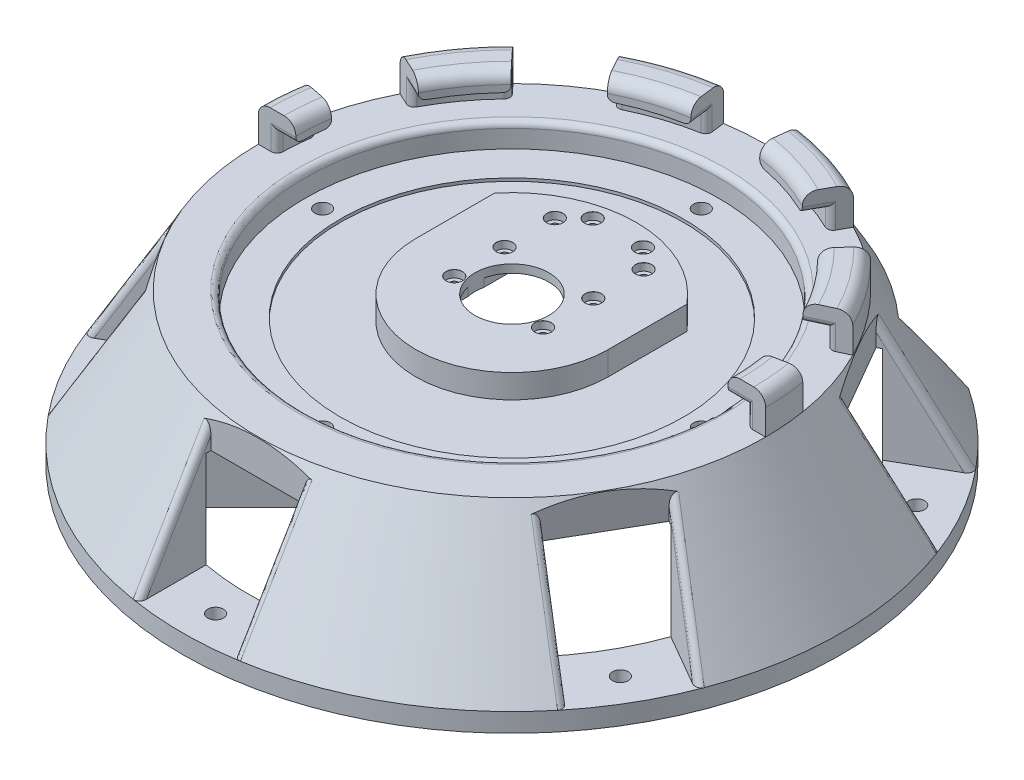
from build123d import *

# Parameters (mm, degrees)
SKETCH2_R                       = 12.5
CUT_EXTRUDE1_DEPTH              = 171.457229262
SKETCH3_R                       = 69.999999954
CUT_EXTRUDE2_DEPTH              = 8.000000002
CUT_EXTRUDE5_DEPTH              = 39
SKETCH8_W                       = 31.75
SKETCH8_H                       = 38.1
CUT_EXTRUDE6_DEPTH              = 44.45
CIRPATTERN2_COUNT               = 6
REVOLVE2_ANGLE                  = 180
CUT_EXTRUDE9_DEPTH              = 12.7
SKETCH3_3_R                     = 12.5
CUT_EXTRUDE11_DEPTH             = 1
CBORE_FOR_M2_5_SHCS1_AT_2_COUNT = 2
CBORE_FOR_M2_5_SHCS1_AT_2_PITCH = 17
CBORE_FOR_M2_5_SHCS1_AT_3_COUNT = 2
CBORE_FOR_M2_5_SHCS1_AT_3_PITCH = 34
CBORE_FOR_M2_5_SHCS1_AT_4_COUNT = 2
CBORE_FOR_M2_5_SHCS1_AT_4_PITCH = 40.820828017
CBORE_FOR_M2_5_SHCS1_AT_5_COUNT = 2
CBORE_FOR_M2_5_SHCS1_AT_5_PITCH = 46.651259361
CBORE_FOR_M2_5_SHCS1_AT_6_COUNT = 2
CBORE_FOR_M2_5_SHCS1_AT_6_PITCH = 45.343136195
CBORE_FOR_M2_5_SHCS1_AT_7_COUNT = 2
CBORE_FOR_M2_5_SHCS1_AT_7_PITCH = 34.481879299
CBORE_FOR_M2_5_SHCS1_AT_8_COUNT = 2
CBORE_FOR_M2_5_SHCS1_AT_8_PITCH = 30
FILLET1_R                       = 4
FILLET2_R                       = 2
FILLET3_R                       = 2
FILLET4_R                       = 2
FILLET5_R                       = 2
FILLET9_R                       = 1
CUT_EXTRUDE12_DEPTH             = 8.05
CUT_EXTRUDE15_START             = -5.3
SKETCH20_R                      = 1.45
CUT_EXTRUDE15_DEPTH             = 5.3
M5_CLEARANCE_HOLE1_D            = 5.3
SKETCH34_R                      = 58
CUT_EXTRUDE16_DEPTH             = 1
BOSS_EXTRUDE1_DEPTH             = 39
FILLET10_R                      = 10
SKETCH37_R                      = 121.388219465
SKETCH37_R_2                    = 111.388219465
CUT_EXTRUDE_THIN1_DEPTH         = 171.457229427
M5_CLEARANCE_HOLE2_D            = 5.3
CIRPATTERN3_COUNT               = 3
CIRPATTERN3_ANGLE               = 120
CIRPATTERN3_THE_OTHER_WAY_COUNT = 3
CIRPATTERN3_THE_OTHER_WAY_ANGLE = 120


with BuildPart() as part:
    # Sketch1 → Revolve1 (revolve)
    with BuildSketch(Plane.XY, mode=Mode.PRIVATE) as revolve1_sk:
        Polygon((0, 0), (-85.725, 0), (-115.054393675, -50.8), (0, -50.8), align=None)
    revolve(revolve1_sk.sketch.rotate(Axis((0, 0, 0), (0, -1, 0)), 270), axis=Axis((0, 0, 0), (0, -1, 0)))

    # Sketch2 → Cut-Extrude1 (cut, through all)
    with BuildSketch(Plane(origin=(0, 0, 0), x_dir=(1, 0, 0), z_dir=(0, 1, 0))):
        with Locations(Location((0, 0, 0), (0, 0, 270))):
            Circle(SKETCH2_R)
    extrude(amount=-CUT_EXTRUDE1_DEPTH, mode=Mode.SUBTRACT)

    # Sketch3 → Cut-Extrude2 (cut)
    with BuildSketch(Plane(origin=(0, 0, 0), x_dir=(1, 0, 0), z_dir=(0, 1, 0))):
        with Locations(Location((0, 0, 0), (0, 0, 270))):
            Circle(SKETCH3_R)
        with BuildLine():
            ThreePointArc((32.5, 0), (0, -32.5), (-32.5, 0))
            Line((-32.5, 0), (-32.5, 26.603571189))
            ThreePointArc((-32.5, 26.603571189), (0, 42), (32.5, 26.603571189))
            Line((32.5, 26.603571189), (32.5, 0))
        make_face(mode=Mode.SUBTRACT)
    extrude(amount=-CUT_EXTRUDE2_DEPTH, mode=Mode.SUBTRACT)

    # Sketch7 → Cut-Extrude5 (cut)
    with BuildSketch(Plane.XZ.offset(50.8)):
        with BuildLine():
            Line((-60, -65.598856697), (-60, -161.1))
            Line((-60, -161.1), (60, -161.1))
            Line((60, -161.1), (60, -65.598856697))
            ThreePointArc((60, -65.598856697), (0, 88.9), (-60, -65.598856697))
        make_face()
    extrude(amount=-CUT_EXTRUDE5_DEPTH, mode=Mode.SUBTRACT)

    # Sketch8 → Cut-Extrude6 (cut)
    with BuildSketch(Plane(origin=(0, 0, 0), x_dir=(1, 0, 0), z_dir=(0, 1, 0))):
        with Locations((0, -104.875)):
            Rectangle(SKETCH8_W, SKETCH8_H)
    cut_extrude6 = extrude(amount=-CUT_EXTRUDE6_DEPTH, mode=Mode.SUBTRACT)

    # CirPattern2: Cut-Extrude6 ×6 about axis, 1 skipped
    cirpattern2_axis = Axis((0, 0, 0), (0, -1, 0))
    add([cut_extrude6.rotate(cirpattern2_axis, i * 360 / CIRPATTERN2_COUNT) for i in range(1, CIRPATTERN2_COUNT) if i not in (3,)], mode=Mode.SUBTRACT)

    # Sketch12 → Revolve2 (revolve)
    with BuildSketch(Plane.XY):
        Polygon((85.725, 0), (85.725, 12.7), (73.025, 12.7), (73.025, 6.35), (79.375, 6.35), (79.375, 0), align=None)
    revolve(axis=Axis((0, 0, 0), (0, 1, 0)), revolution_arc=REVOLVE2_ANGLE)

    # Sketch18 → Cut-Extrude9 (cut)
    with BuildSketch(Plane(origin=(0, 12.7, 0), x_dir=(1, 0, 0), z_dir=(0, 1, 0))):
        Polygon((46.643270314, 89.718478222), (70.913780145, 72.084920653), (36.670415564, 35.160782448), (22.108109665, 45.740916989), align=None)
        Polygon((-15, 100), (-9, 50), (9, 50), (15, 100), align=None)
        Polygon((90.470396714, 45.167547182), (99.740906545, 16.635851693), (50.333978764, 6.891341072), (44.771672865, 24.010358365), align=None)
        Polygon((99.740906545, -16.635851693), (90.470396714, -45.167547182), (44.771672865, -24.010358365), (50.333978764, -6.891341072), align=None)
        Polygon((70.913780145, -72.084920653), (46.643270314, -89.718478222), (22.108109665, -45.740916989), (36.670415564, -35.160782448), align=None)
        Polygon((15, -100), (-15, -100), (-9, -50), (9, -50), align=None)
        Polygon((-46.643270314, -89.718478222), (-70.913780145, -72.084920653), (-36.670415564, -35.160782448), (-22.108109665, -45.740916989), align=None)
        Polygon((-90.470396714, -45.167547182), (-99.740906545, -16.635851693), (-50.333978764, -6.891341072), (-44.771672865, -24.010358365), align=None)
        Polygon((-99.740906545, 16.635851693), (-90.470396714, 45.167547182), (-44.771672865, 24.010358365), (-50.333978764, 6.891341072), align=None)
        Polygon((-70.913780145, 72.084920653), (-46.643270314, 89.718478222), (-22.108109665, 45.740916989), (-36.670415564, 35.160782448), align=None)
    extrude(amount=-CUT_EXTRUDE9_DEPTH, mode=Mode.SUBTRACT)

    # Sketch3<3> → Cut-Extrude11 (cut)
    # profile 1 of 5: a face of its own
    with BuildSketch(Plane(origin=(0, 0, 0), x_dir=(1, 0, 0), z_dir=(0, 1, 0))):
        with BuildLine():
            ThreePointArc((-18.668154703, 26.603571189), (-28.835438507, 14.992247533), (-32.5, 0))
            ThreePointArc((-32.5, 0), (0, -32.5), (32.5, 0))
            ThreePointArc((32.5, 0), (28.835438507, 14.992247533), (18.668154703, 26.603571189))
            Line((18.668154703, 26.603571189), (-18.668154703, 26.603571189))
        make_face()
        with Locations(Location((0, 0, 0), (0, 0, 270))):
            Circle(SKETCH3_3_R, mode=Mode.SUBTRACT)
    # profile 2 of 5: a face of its own
    with BuildSketch(Plane(origin=(0, 0, 0), x_dir=(1, 0, 0), z_dir=(0, 1, 0))):
        with BuildLine():
            Line((-32.5, 26.603571189), (-32.5, 0))
            ThreePointArc((-32.5, 0), (-28.835438507, 14.992247533), (-18.668154703, 26.603571189))
            Line((-18.668154703, 26.603571189), (-32.5, 26.603571189))
        make_face()
    # profile 3 of 5: a face of its own
    with BuildSketch(Plane(origin=(0, 0, 0), x_dir=(1, 0, 0), z_dir=(0, 1, 0))):
        with BuildLine():
            ThreePointArc((18.668154703, 26.603571189), (0, 32.5), (-18.668154703, 26.603571189))
            Line((-18.668154703, 26.603571189), (18.668154703, 26.603571189))
        make_face()
    # profile 4 of 5: a face of its own
    with BuildSketch(Plane(origin=(0, 0, 0), x_dir=(1, 0, 0), z_dir=(0, 1, 0))):
        with BuildLine():
            ThreePointArc((32.5, 26.603571189), (0, 42), (-32.5, 26.603571189))
            Line((-32.5, 26.603571189), (-18.668154703, 26.603571189))
            ThreePointArc((-18.668154703, 26.603571189), (0, 32.5), (18.668154703, 26.603571189))
            Line((18.668154703, 26.603571189), (32.5, 26.603571189))
        make_face()
    # profile 5 of 5: a face of its own
    with BuildSketch(Plane(origin=(0, 0, 0), x_dir=(1, 0, 0), z_dir=(0, 1, 0))):
        with BuildLine():
            ThreePointArc((18.668154703, 26.603571189), (28.835438507, 14.992247533), (32.5, 0))
            Line((32.5, 0), (32.5, 26.603571189))
            Line((32.5, 26.603571189), (18.668154703, 26.603571189))
        make_face()
    extrude(amount=-CUT_EXTRUDE11_DEPTH, mode=Mode.SUBTRACT)

    # Sketch24 → CBORE for M2.5 SHCS1 (revolve, cut)
    with BuildSketch(Plane(origin=(-15, -1, 4.5), x_dir=(0, 0, 1), z_dir=(1, 0, 0))):
        Polygon((0, 0), (0, 49.8), (1.45, 49.8), (1.45, 2.5), (2.75, 2.5), (2.75, 0.025), (2.775, 0), align=None)
    cbore_for_m2_5_shcs1 = revolve(axis=Axis((-15, 5.35, 4.5), (0, -1, 0)), mode=Mode.SUBTRACT)

    # CBORE for M2.5 SHCS1 at 2: CBORE for M2.5 SHCS1 ×2
    with Locations(*[(0, 0, -i * CBORE_FOR_M2_5_SHCS1_AT_2_PITCH) for i in range(1, CBORE_FOR_M2_5_SHCS1_AT_2_COUNT)]):
        add(cbore_for_m2_5_shcs1, mode=Mode.SUBTRACT)

    # CBORE for M2.5 SHCS1 at 3: CBORE for M2.5 SHCS1 ×2
    with Locations(*[(0, 0, -i * CBORE_FOR_M2_5_SHCS1_AT_3_PITCH) for i in range(1, CBORE_FOR_M2_5_SHCS1_AT_3_COUNT)]):
        add(cbore_for_m2_5_shcs1, mode=Mode.SUBTRACT)

    # CBORE for M2.5 SHCS1 at 4: CBORE for M2.5 SHCS1 ×2
    with Locations(*[Vector(0.15923243882462063, 0, -0.9872411207126472) * (i * CBORE_FOR_M2_5_SHCS1_AT_4_PITCH) for i in range(1, CBORE_FOR_M2_5_SHCS1_AT_4_COUNT)]):
        add(cbore_for_m2_5_shcs1, mode=Mode.SUBTRACT)

    # CBORE for M2.5 SHCS1 at 5: CBORE for M2.5 SHCS1 ×2
    with Locations(*[Vector(0.5037377408822789, 0, -0.8638566364917376) * (i * CBORE_FOR_M2_5_SHCS1_AT_5_PITCH) for i in range(1, CBORE_FOR_M2_5_SHCS1_AT_5_COUNT)]):
        add(cbore_for_m2_5_shcs1, mode=Mode.SUBTRACT)

    # CBORE for M2.5 SHCS1 at 6: CBORE for M2.5 SHCS1 ×2
    with Locations(*[Vector(0.6616216370868465, 0, -0.7498378553650925) * (i * CBORE_FOR_M2_5_SHCS1_AT_6_PITCH) for i in range(1, CBORE_FOR_M2_5_SHCS1_AT_6_COUNT)]):
        add(cbore_for_m2_5_shcs1, mode=Mode.SUBTRACT)

    # CBORE for M2.5 SHCS1 at 7: CBORE for M2.5 SHCS1 ×2
    with Locations(*[Vector(0.8700221858486125, 0, -0.4930125719808802) * (i * CBORE_FOR_M2_5_SHCS1_AT_7_PITCH) for i in range(1, CBORE_FOR_M2_5_SHCS1_AT_7_COUNT)]):
        add(cbore_for_m2_5_shcs1, mode=Mode.SUBTRACT)

    # CBORE for M2.5 SHCS1 at 8: CBORE for M2.5 SHCS1 ×2
    with Locations(*[(i * CBORE_FOR_M2_5_SHCS1_AT_8_PITCH, 0, 0) for i in range(1, CBORE_FOR_M2_5_SHCS1_AT_8_COUNT)]):
        add(cbore_for_m2_5_shcs1, mode=Mode.SUBTRACT)

    # Fillet1
    fillet1_edges = [part.edges().sort_by_distance(p)[0] for p in [
        (-85.450905057, 12.7, -6.849704366),
        (-72.808821363, 12.7, -5.614815819),
        (-59.078466014, 12.7, -42.923018049),
        (-22.565966014, 12.7, -69.450902102),
        (22.565966014, 12.7, -69.450902102),
        (59.078466014, 12.7, -42.923018049),
        (72.808821363, 12.7, -5.614815819),
        (-69.352981843, 12.7, -50.387890753),
        (-26.490481843, 12.7, -81.529319859),
        (26.490481843, 12.7, -81.529319859),
        (69.352981843, 12.7, -50.387890753),
        (85.450905057, 12.7, -6.849704365),
    ]]
    fillet(fillet1_edges, radius=FILLET1_R)

    # Fillet2
    fillet2_edges = [part.edges().sort_by_distance(p)[0] for p in [
        (-76.2, 6.35, 0),
        (76.2, 6.35, 0),
        (67.844410645, 6.35, -34.692369341),
        (75.278944251, 6.35, -11.811227656),
        (34.49561812, 6.35, -67.9446604),
        (53.95947979, 6.35, -53.803337137),
        (-75.278944251, 6.35, -11.811227656),
        (-67.844410645, 6.35, -34.692369341),
        (-53.95947979, 6.35, -53.803337137),
        (-34.49561812, 6.35, -67.9446604),
        (12.029328065, 6.35, -75.24440054),
        (-12.029328065, 6.35, -75.24440054),
    ]]
    fillet(fillet2_edges, radius=FILLET2_R)

    # Fillet3
    fillet3_edges = [part.edges().sort_by_distance(p)[0] for p in [
        (-78.396323126, 4.175, -12.426067172),
        (-56.120098678, 4.175, -56.133102082),
        (-70.727816733, 4.175, -36.027303052),
        (-12.407903987, 4.175, -78.399199892),
        (56.120098678, 4.175, -56.133102082),
        (78.396323126, 4.175, -12.426067171),
        (-79.375, 4.175, 0),
        (-36.043688298, 4.175, -70.719468033),
        (12.407903987, 4.175, -78.399199892),
        (36.043688298, 4.175, -70.719468033),
        (70.727816733, 4.175, -36.027303052),
        (79.375, 4.175, 0),
    ]]
    fillet(fillet3_edges, radius=FILLET3_R)

    # Fillet4
    fillet4_edges = [part.edges().sort_by_distance(p)[0] for p in [
        (92.853698409, -23.56380487, 35.278236725),
        (76.978698409, -23.56380487, 62.774543295),
        (76.978698409, -23.56380487, -62.774543295),
        (92.853698409, -23.56380487, -35.278236725),
        (-92.853698409, -23.56380487, -35.278236725),
        (-76.978698409, -23.56380487, -62.774543295),
        (-76.978698409, -23.56380487, 62.774543295),
        (-92.853698409, -23.56380487, 35.278236725),
        (15.875, -23.56380487, 98.05278002),
        (-15.875, -23.56380487, 98.05278002),
    ]]
    fillet(fillet4_edges, radius=FILLET4_R)

    # Fillet5
    fillet5_edges = [part.edges().sort_by_distance(p)[0] for p in [
        (0, 0, -69.999999954),
    ]]
    fillet(fillet5_edges, radius=FILLET5_R)

    # Fillet9
    fillet9_edges = [part.edges().sort_by_distance(p)[0] for p in [
        (-60, -31.116866881, -84.56763471),
        (60, -31.116866881, -84.56763471),
    ]]
    fillet(fillet9_edges, radius=FILLET9_R)

    # Sketch28 → Cut-Extrude12 (cut)
    with BuildSketch(Plane.XZ.offset(11.8)):
        with BuildLine():
            Line((9.201931173, 13.289226486), (-9.201931173, 13.289226486))
            ThreePointArc((-9.201931173, 13.289226486), (-11.957049504, 12.022586474), (-12.2, 9))
            Line((-12.2, 9), (-12.2, -30))
            ThreePointArc((-12.2, -30), (-11.321320344, -32.121320344), (-9.2, -33))
            Line((-9.2, -33), (9.2, -33))
            ThreePointArc((9.2, -33), (11.321320344, -32.121320344), (12.2, -30))
            Line((12.2, -30), (12.2, 9))
            ThreePointArc((12.2, 9), (11.957049504, 12.022586474), (9.201931173, 13.289226486))
        make_face()
    extrude(amount=-CUT_EXTRUDE12_DEPTH, mode=Mode.SUBTRACT)

    # Sketch20 → Cut-Extrude15 (cut)
    with BuildSketch(Plane.XZ.offset(11.8).offset(CUT_EXTRUDE15_START)):
        Polygon((-22.5, 23), (-22.5, -33), (-12.5, -40), (12.5, -40), (22.5, -33), (22.5, 23), align=None)
        with Locations(Location((-15, -29.5, 0), (0, 0, 90))):
            Circle(SKETCH20_R, mode=Mode.SUBTRACT)
        with Locations(Location((-8.5, -35.8, 0), (0, 0, 90))):
            Circle(SKETCH20_R, mode=Mode.SUBTRACT)
        with Locations(Location((-15, -12.5, 0), (0, 0, 90))):
            Circle(SKETCH20_R, mode=Mode.SUBTRACT)
        with Locations(Location((8.5, -35.8, 0), (0, 0, 90))):
            Circle(SKETCH20_R, mode=Mode.SUBTRACT)
        with Locations(Location((15, -29.5, 0), (0, 0, 90))):
            Circle(SKETCH20_R, mode=Mode.SUBTRACT)
        with BuildLine():
            ThreePointArc((9.201931173, 13.289226486), (11.957049504, 12.022586474), (12.2, 9))
            Line((12.2, 9), (12.2, 2.722131518))
            ThreePointArc((12.2, 2.722131518), (12.5, 0), (12.2, -2.722131518))
            Line((12.2, -2.722131518), (12.2, -30))
            ThreePointArc((12.2, -30), (11.321320344, -32.121320344), (9.2, -33))
            Line((9.2, -33), (-9.2, -33))
            ThreePointArc((-9.2, -33), (-11.321320344, -32.121320344), (-12.2, -30))
            Line((-12.2, -30), (-12.2, -2.722131518))
            ThreePointArc((-12.2, -2.722131518), (-12.5, 0), (-12.2, 2.722131518))
            Line((-12.2, 2.722131518), (-12.2, 9))
            ThreePointArc((-12.2, 9), (-11.957049504, 12.022586474), (-9.201931173, 13.289226486))
            Line((-9.201931173, 13.289226486), (9.201931173, 13.289226486))
        make_face(mode=Mode.SUBTRACT)
        with Locations(Location((15, -12.5, 0), (0, 0, 90))):
            Circle(SKETCH20_R, mode=Mode.SUBTRACT)
        with Locations(Location((-15, 4.5, 0), (0, 0, 90))):
            Circle(SKETCH20_R, mode=Mode.SUBTRACT)
        with Locations(Location((15, 4.5, 0), (0, 0, 90))):
            Circle(SKETCH20_R, mode=Mode.SUBTRACT)
    extrude(amount=CUT_EXTRUDE15_DEPTH, mode=Mode.SUBTRACT)

    # M5 Clearance Hole1 (through all)
    with Locations(Plane(origin=(0, -8.000000002, 0), x_dir=(1, 0, 0), z_dir=(0, 1, 0))):
        with Locations((0, 64), (64, 0), (0, -64), (-64, 0)):
            Hole(M5_CLEARANCE_HOLE1_D / 2)

    # Sketch34 → Cut-Extrude16 (cut)
    with BuildSketch(Plane(origin=(0, -8.000000002, 0), x_dir=(1, 0, 0), z_dir=(0, 1, 0))):
        with Locations(Location((0, 0, 0), (0, 0, 270))):
            Circle(SKETCH34_R)
        with BuildLine():
            ThreePointArc((32.5, 0), (0, -32.5), (-32.5, 0))
            Line((-32.5, 0), (-32.5, 26.603571189))
            ThreePointArc((-32.5, 26.603571189), (0, 42), (32.5, 26.603571189))
            Line((32.5, 26.603571189), (32.5, 0))
        make_face(mode=Mode.SUBTRACT)
    extrude(amount=-CUT_EXTRUDE16_DEPTH, mode=Mode.SUBTRACT)

    # Sketch39 → Boss-Extrude1 (add)
    with BuildSketch(Plane.XZ.offset(50.8)):
        with BuildLine():
            ThreePointArc((-48.831845645, 74.287689767), (-56.138266806, 68.932612021), (-62.861792847, 62.861792847))
            Line((-62.861792847, 62.861792847), (-35.355339059, 35.355339059))
            Line((-35.355339059, 35.355339059), (-22.627416998, 48.083261121))
            Line((-22.627416998, 48.083261121), (-48.831845645, 74.287689767))
        make_face()
        with BuildLine():
            Line((-72, 12.5), (-88.016816575, 12.5))
            ThreePointArc((-88.016816575, 12.5), (-88.9, 0), (-88.016816575, -12.5))
            Line((-88.016816575, -12.5), (-72, -12.5))
            Line((-72, -12.5), (-72, 12.5))
        make_face()
        with BuildLine():
            ThreePointArc((62.861792847, 62.861792847), (56.138266806, 68.932612021), (48.831845645, 74.287689767))
            Line((48.831845645, 74.287689767), (22.627416998, 48.083261121))
            Line((22.627416998, 48.083261121), (35.355339059, 35.355339059))
            Line((35.355339059, 35.355339059), (62.861792847, 62.861792847))
        make_face()
        with BuildLine():
            ThreePointArc((88.016816575, -12.5), (88.9, 0), (88.016816575, 12.5))
            Line((88.016816575, 12.5), (72, 12.5))
            Line((72, 12.5), (72, -12.5))
            Line((72, -12.5), (88.016816575, -12.5))
        make_face()
    extrude(amount=-BOSS_EXTRUDE1_DEPTH)

    # Fillet10
    fillet10_edges = [part.edges().sort_by_distance(p)[0] for p in [
        (-28.991378029, -11.8, 41.71930009),
        (28.991378029, -11.8, 41.71930009),
    ]]
    fillet(fillet10_edges, radius=FILLET10_R)

    # Sketch37 → Cut-Extrude-Thin1 (cut, through all)
    with BuildSketch(Plane(origin=(0, 0, 0), x_dir=(1, 0, 0), z_dir=(0, 1, 0))):
        Circle(SKETCH37_R)
        Circle(SKETCH37_R_2, mode=Mode.SUBTRACT)
    extrude(amount=-CUT_EXTRUDE_THIN1_DEPTH, mode=Mode.SUBTRACT)

    # M5 Clearance Hole2 (through all)
    with Locations(Plane(origin=(0, -44.45, 0), x_dir=(1, 0, 0), z_dir=(0, 1, 0))):
        with Locations((0, -100.14410974)):
            m5_clearance_hole2 = Hole(M5_CLEARANCE_HOLE2_D / 2)

    # CirPattern3: M5 Clearance Hole2 ×3 about axis
    cirpattern3_axis = Axis((0, 0, 0), (0, 1, 0))
    for i in range(1, CIRPATTERN3_COUNT):
        add(m5_clearance_hole2.rotate(cirpattern3_axis, i * CIRPATTERN3_ANGLE / (CIRPATTERN3_COUNT - 1)), mode=Mode.SUBTRACT)

    # CirPattern3 the other way: M5 Clearance Hole2 ×3 about axis
    cirpattern3_the_other_way_axis = Axis((0, 0, 0), (0, -1, 0))
    for i in range(1, CIRPATTERN3_THE_OTHER_WAY_COUNT):
        add(m5_clearance_hole2.rotate(cirpattern3_the_other_way_axis, i * CIRPATTERN3_THE_OTHER_WAY_ANGLE / (CIRPATTERN3_THE_OTHER_WAY_COUNT - 1)), mode=Mode.SUBTRACT)


solid = part.part
